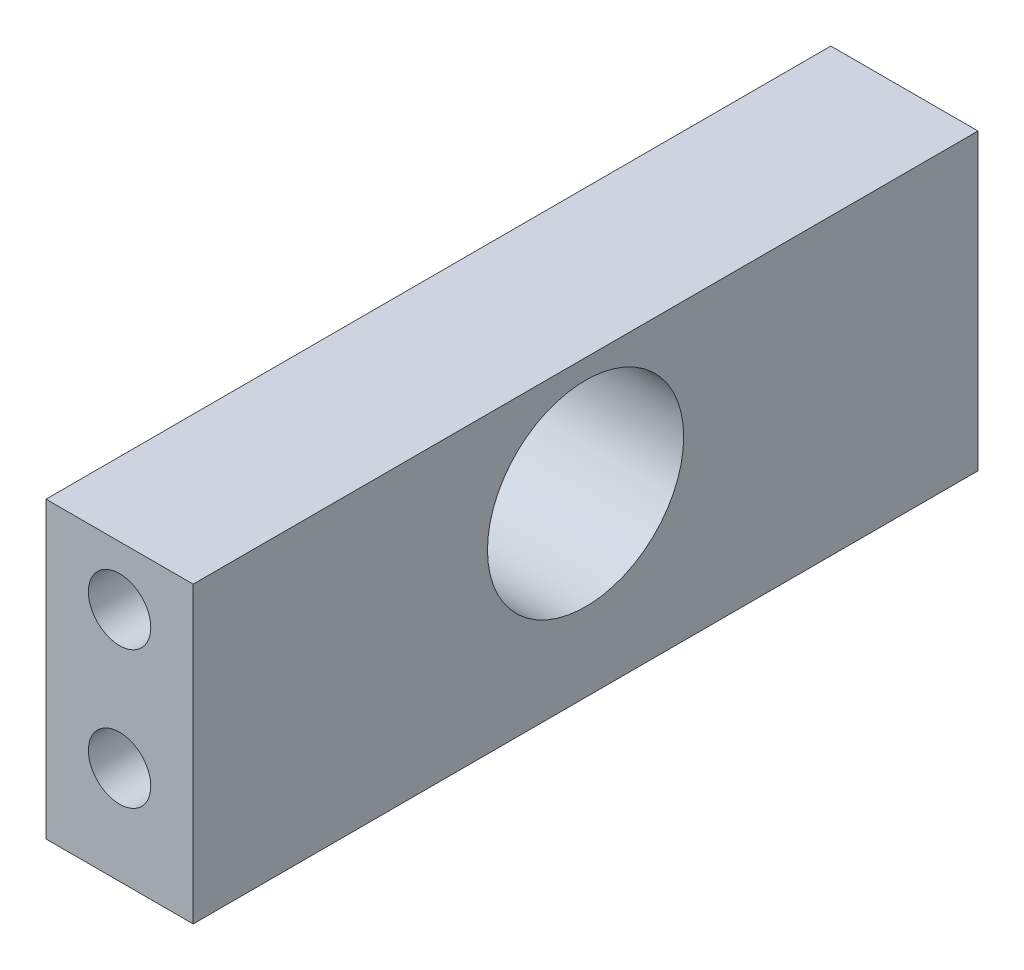
from build123d import *

# Parameters (mm, degrees)
SKETCH1_W                      = 50.8
SKETCH1_H                      = 19.05
BOSS_EXTRUDE1_DEPTH            = 9.525
F_1_2_0_5_DIAMETER_HOLE1_D     = 12.7
F_1_2_0_5_DIAMETER_HOLE1_DEPTH = 70.104
F_1_2_0_5_DIAMETER_HOLE1_TIP   = 3.815464931
F_10_32_TAPPED_HOLE1_D         = 4.0386
F_10_32_TAPPED_HOLE1_DEPTH     = 11.938
F_10_32_TAPPED_HOLE1_TIP       = 1.213317848


with BuildPart() as part:
    # Sketch1 → Boss-Extrude1 (new body)
    with BuildSketch(Plane(origin=(0, 0, 0), x_dir=(0, 0, -1), z_dir=(1, 0, 0))):
        Rectangle(SKETCH1_W, SKETCH1_H)
    extrude(amount=BOSS_EXTRUDE1_DEPTH)

    # 1/2 (0.5) Diameter Hole1
    with Locations(Plane(origin=(9.525, 0, 0), x_dir=(0, 0, -1), z_dir=(1, 0, 0))):
        with Locations((0, 1.905)):
            Hole(F_1_2_0_5_DIAMETER_HOLE1_D / 2, depth=F_1_2_0_5_DIAMETER_HOLE1_DEPTH)
            with Locations((0, 0, -(F_1_2_0_5_DIAMETER_HOLE1_DEPTH + F_1_2_0_5_DIAMETER_HOLE1_TIP / 2))):  # 118° drill point
                Cone(0, F_1_2_0_5_DIAMETER_HOLE1_D / 2, F_1_2_0_5_DIAMETER_HOLE1_TIP, mode=Mode.SUBTRACT)

    # #10-32 Tapped Hole1
    with Locations(Plane(origin=(-0.103043464, -5.333920775, 25.4), x_dir=(-1, 0, 0), z_dir=(0, 0, 1))):
        with Locations((-4.865543464, -2.158920775), (-4.865543464, -11.048920775)):
            Hole(F_10_32_TAPPED_HOLE1_D / 2, depth=F_10_32_TAPPED_HOLE1_DEPTH)
            with Locations((0, 0, -(F_10_32_TAPPED_HOLE1_DEPTH + F_10_32_TAPPED_HOLE1_TIP / 2))):  # 118° drill point
                Cone(0, F_10_32_TAPPED_HOLE1_D / 2, F_10_32_TAPPED_HOLE1_TIP, mode=Mode.SUBTRACT)


solid = part.part
